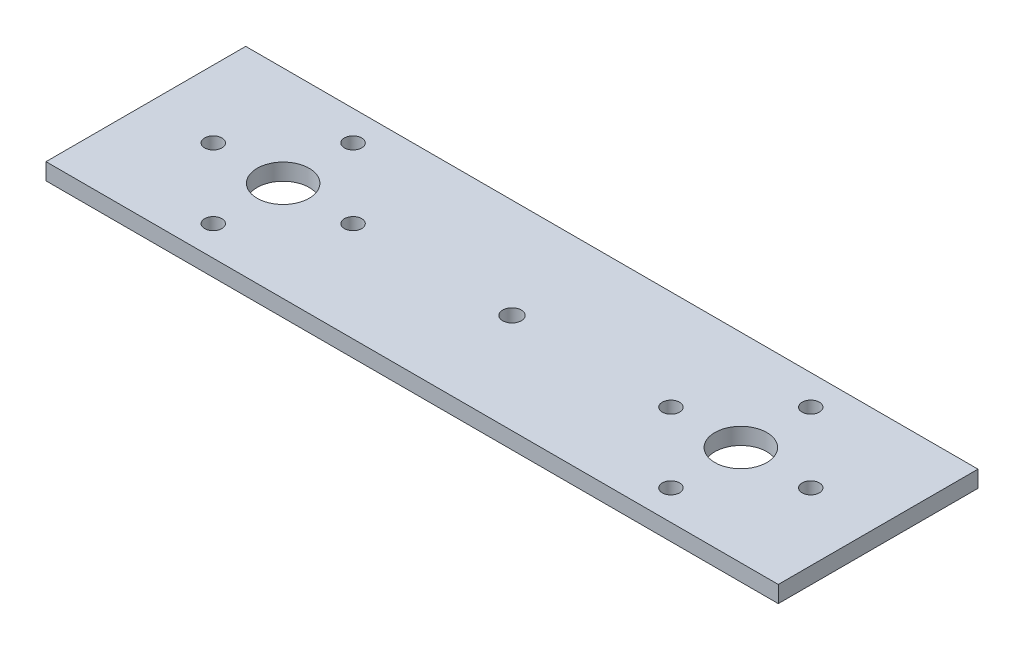
from build123d import *

# Parameters (mm, degrees)
SKETCH1_W                        = 279.4
SKETCH1_H                        = 76.2
BOSS_EXTRUDE1_DEPTH              = 6.35
F_25_32_0_78125_DIAMETER_HOLE1_D = 19.84375
SKETCH6_R                        = 3.302
CUT_EXTRUDE1_DEPTH               = 6.35
CIRPATTERN1_COUNT                = 4
MIRROR2_COPY_1_SKETCH_R          = 3.302
MIRROR2_COPY_1_DEPTH             = 6.35
MIRROR2_COPY_2_SKETCH_R          = 3.302
MIRROR2_COPY_2_DEPTH             = 6.35
MIRROR2_COPY_3_SKETCH_R          = 3.302
MIRROR2_COPY_3_DEPTH             = 6.35
MIRROR2_COPY_4_SKETCH_R          = 3.302
MIRROR2_COPY_4_DEPTH             = 6.35
SKETCH7_R                        = 3.556
CUT_EXTRUDE2_DEPTH               = 6.35


with BuildPart() as part:
    # Sketch1 → Boss-Extrude1 (new body)
    with BuildSketch(Plane(origin=(0, 0, 0), x_dir=(1, 0, 0), z_dir=(0, 1, 0))):
        Rectangle(SKETCH1_W, SKETCH1_H)
    extrude(amount=BOSS_EXTRUDE1_DEPTH)

    # 25/32 (0.78125) Diameter Hole1 (through all)
    with Locations(Plane(origin=(0, 6.35, 0), x_dir=(1, 0, 0), z_dir=(0, 1, 0))):
        with Locations((87.3125, 0)):
            f_25_32_0_78125_diameter_hole1 = Hole(F_25_32_0_78125_DIAMETER_HOLE1_D / 2)

    # Sketch6 → Cut-Extrude1 (cut)
    with BuildSketch(Plane(origin=(0, 6.35, 0), x_dir=(1, 0, 0), z_dir=(0, 1, 0))):
        with Locations((60.6425, 0)):
            Circle(SKETCH6_R)
    cut_extrude1 = extrude(amount=-CUT_EXTRUDE1_DEPTH, mode=Mode.SUBTRACT)

    # CirPattern1: Cut-Extrude1 ×4 about axis
    cirpattern1_axis = Axis((87.3125, 6.35, 0), (0, 1, 0))
    for i in range(1, CIRPATTERN1_COUNT):
        add(cut_extrude1.rotate(cirpattern1_axis, i * 360 / CIRPATTERN1_COUNT), mode=Mode.SUBTRACT)

    # Mirror2: 25/32 (0.78125) Diameter Hole1 across plane
    add(f_25_32_0_78125_diameter_hole1.mirror(Plane(origin=(0, 0, 0), x_dir=(0, 0, 1), z_dir=(1, 0, 0))), mode=Mode.SUBTRACT)

    # Mirror2 copy 1 sketch → Mirror2 copy 1 (cut)
    with BuildSketch(Plane(origin=(-87.3125, 6.35, 87.3125), x_dir=(0, 0, -1), z_dir=(0, 1, 0))):
        with Locations((60.6425, 0)):
            Circle(MIRROR2_COPY_1_SKETCH_R)
    extrude(amount=-MIRROR2_COPY_1_DEPTH, mode=Mode.SUBTRACT)

    # Mirror2 copy 2 sketch → Mirror2 copy 2 (cut)
    with BuildSketch(Plane(origin=(-174.625, 6.35, 0), x_dir=(1, 0, 0), z_dir=(0, 1, 0))):
        with Locations((60.6425, 0)):
            Circle(MIRROR2_COPY_2_SKETCH_R)
    extrude(amount=-MIRROR2_COPY_2_DEPTH, mode=Mode.SUBTRACT)

    # Mirror2 copy 3 sketch → Mirror2 copy 3 (cut)
    with BuildSketch(Plane(origin=(-87.3125, 6.35, -87.3125), x_dir=(0, 0, 1), z_dir=(0, 1, 0))):
        with Locations((60.6425, 0)):
            Circle(MIRROR2_COPY_3_SKETCH_R)
    extrude(amount=-MIRROR2_COPY_3_DEPTH, mode=Mode.SUBTRACT)

    # Mirror2 copy 4 sketch → Mirror2 copy 4 (cut)
    with BuildSketch(Plane(origin=(0, 6.35, 0), x_dir=(-1, 0, 0), z_dir=(0, 1, 0))):
        with Locations((60.6425, 0)):
            Circle(MIRROR2_COPY_4_SKETCH_R)
    extrude(amount=-MIRROR2_COPY_4_DEPTH, mode=Mode.SUBTRACT)

    # Sketch7 → Cut-Extrude2 (cut)
    with BuildSketch(Plane(origin=(0, 0, 0), x_dir=(-1, 0, 0), z_dir=(0, -1, 0))):
        Circle(SKETCH7_R)
    extrude(amount=-CUT_EXTRUDE2_DEPTH, mode=Mode.SUBTRACT)


solid = part.part
